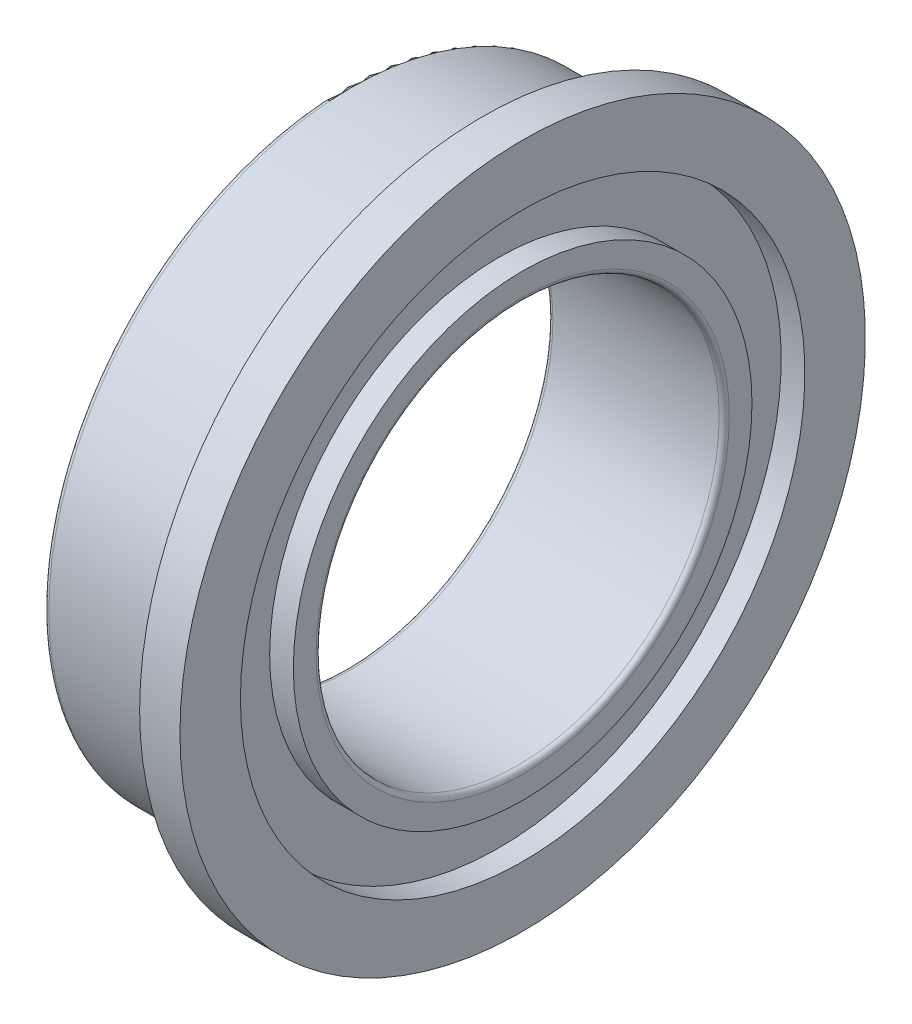
from build123d import *

# Parameters (mm, degrees)
FILLET1_R = 0.1


with BuildPart() as part:
    # Sketch1 → Revolve1 (revolve)
    with BuildSketch(Plane.XY):
        with BuildLine():
            Line((0, 6.2), (0, 6.8))
            Line((0, 6.8), (0.8, 6.8))
            Line((0.8, 6.8), (0.8, 5.6))
            Line((0.8, 5.6), (0.33, 5.6))
            Line((0.33, 5.6), (0.33, 4.55))
            Line((0.33, 4.55), (0.8, 4.55))
            Line((0.8, 4.55), (0.8, 4))
            Line((0.8, 4), (-2.7, 4))
            Line((-2.7, 4), (-2.7, 4.55))
            Line((-2.7, 4.55), (-2.23, 4.55))
            Line((-2.23, 4.55), (-2.23, 5.6))
            Line((-2.23, 5.6), (-2.7, 5.6))
            Line((-2.7, 5.6), (-2.7, 6))
            Line((-2.7, 6), (-0.2, 6))
            ThreePointArc((-0.2, 6), (0.141421356, 5.858578644), (0, 6.2))
        make_face()
    revolve(axis=Axis((-2.7, 0, 0), (1, 0, 0)))

    # Fillet1
    fillet1_edges = [part.edges().sort_by_distance(p)[0] for p in [
        (0.8, -4, 0),
        (-2.7, -4, 0),
        (-2.7, -6, 0),
    ]]
    fillet(fillet1_edges, radius=FILLET1_R)


solid = part.part
